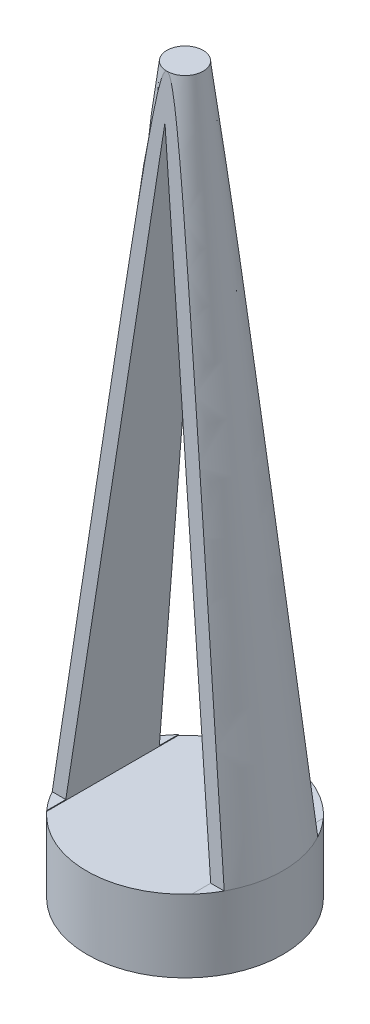
from build123d import *

# Parameters (mm, degrees)
CUT_EXTRUDE1_DEPTH      = 102.806188417
CUT_EXTRUDE1_DEPTH_BACK = 102.806188417
CUT_EXTRUDE2_DEPTH      = 102.657794059
CUT_EXTRUDE2_DEPTH_BACK = 102.657794059


with BuildPart() as part:
    # Sketch1 → Revolve1 (revolve)
    with BuildSketch(Plane.XY):
        Polygon((-13.5, 0), (-13.5, 10), (-2.5, 100), (0, 100), (0, 0), align=None)
    revolve(axis=Axis((0, 0, 0), (0, 1, 0)))

    # Sketch3 → Cut-Extrude1 (cut, two sides: drawn at the far end of the back side and taken through both)
    with BuildSketch(Plane(origin=(0, 0, 0), x_dir=(0, 0, -1), z_dir=(1, 0, 0)).offset(-CUT_EXTRUDE1_DEPTH_BACK)):
        Polygon((-29.451982923, 10), (-6.451982923, 10), (-2.5, 100), (-29.451982923, 100), align=None)
        Polygon((29.451982923, 10), (6.451982923, 10), (2.5, 100), (29.451982923, 100), align=None)
    extrude(amount=CUT_EXTRUDE1_DEPTH + CUT_EXTRUDE1_DEPTH_BACK, mode=Mode.SUBTRACT)

    # Sketch4 → Cut-Extrude2 (cut, two sides: drawn at the far end of the back side and taken through both)
    with BuildSketch(Plane(origin=(0, 0.151078659, 0), x_dir=(1, 0, 0), z_dir=(0, 0, 1)).offset(-CUT_EXTRUDE2_DEPTH_BACK)):
        Polygon((-10, 9.73635876), (10, 9.848921341), (0, 93.839476738), align=None)
    extrude(amount=CUT_EXTRUDE2_DEPTH + CUT_EXTRUDE2_DEPTH_BACK, mode=Mode.SUBTRACT)


solid = part.part
